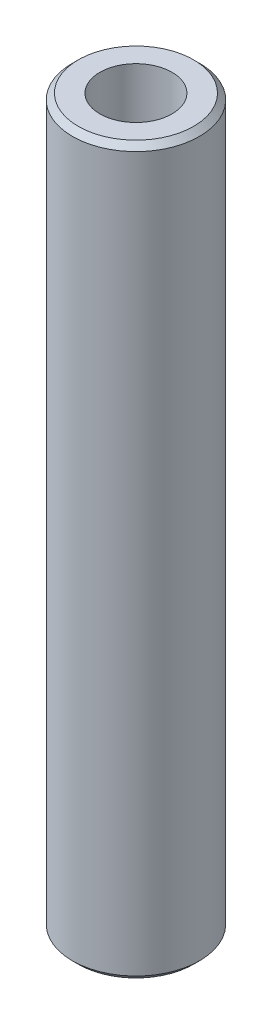
from build123d import *

# Parameters (mm, degrees)
SKETCH1_R           = 52.5
BOSS_EXTRUDE1_DEPTH = 600
SKETCH2_R           = 29.831445167
CUT_EXTRUDE1_DEPTH  = 605.576297914
CHAMFER1_SIZE       = 4.804970193


with BuildPart() as part:
    # Sketch1 → Boss-Extrude1 (new body)
    with BuildSketch(Plane(origin=(0, 0, 0), x_dir=(1, 0, 0), z_dir=(0, 1, 0))):
        Circle(SKETCH1_R)
    extrude(amount=BOSS_EXTRUDE1_DEPTH)

    # Sketch2 → Cut-Extrude1 (cut, through all)
    with BuildSketch(Plane(origin=(0, 0, 0), x_dir=(1, 0, 0), z_dir=(0, 1, 0))):
        Circle(SKETCH2_R)
    extrude(amount=CUT_EXTRUDE1_DEPTH, mode=Mode.SUBTRACT)

    # Chamfer1
    chamfer1_edges = [part.edges().sort_by_distance(p)[0] for p in [
        (-52.5, 600, 0),
        (-52.5, 0, 0),
    ]]
    chamfer(chamfer1_edges, length=CHAMFER1_SIZE)


solid = part.part
